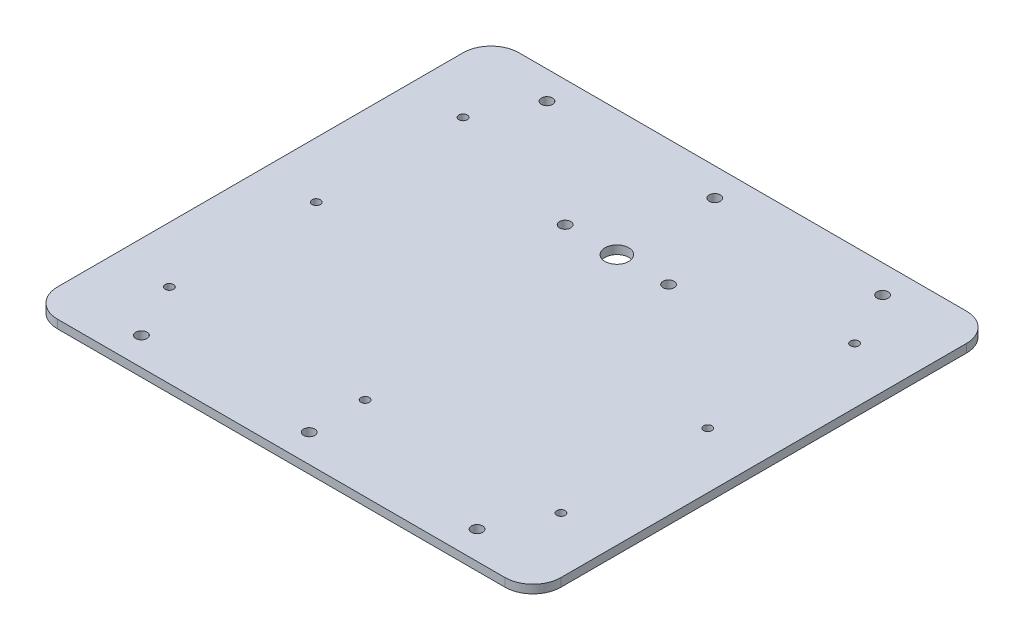
from build123d import *

# Parameters (mm, degrees)
SKETCH_1_R             = 2
SKETCH_1_R_2           = 4.25
SKETCH_1_R_3           = 1.5
SM_BASE_FLANGE_1_DEPTH = 3


# Sheet-metal steps are written as plain solids
with BuildPart() as part:
    # Sketch 1 → 基体-法兰1 (new body)
    with BuildSketch(Plane(origin=(0, 0, 0), x_dir=(1, 0, 0), z_dir=(0, 1, 0))):
        with BuildLine():
            Line((-80, 82.5), (80, 82.5))
            ThreePointArc((80, 82.5), (87.071067812, 79.571067812), (90, 72.5))
            Line((90, 72.5), (90, -72.5))
            ThreePointArc((90, -72.5), (87.071067812, -79.571067812), (80, -82.5))
            Line((80, -82.5), (-80, -82.5))
            ThreePointArc((-80, -82.5), (-87.071067812, -79.571067812), (-90, -72.5))
            Line((-90, -72.5), (-90, 72.5))
            ThreePointArc((-90, 72.5), (-87.071067812, 79.571067812), (-80, 82.5))
        make_face()
        with Locations(Location((0, 72.5, 0), (0, 0, 270))):
            Circle(SKETCH_1_R, mode=Mode.SUBTRACT)
        with Locations(Location((60, 72.5, 0), (0, 0, 270))):
            Circle(SKETCH_1_R, mode=Mode.SUBTRACT)
        with Locations(Location((-60, 72.5, 0), (0, 0, 270))):
            Circle(SKETCH_1_R, mode=Mode.SUBTRACT)
        with Locations(Location((0, -72.5, 0), (0, 0, 270))):
            Circle(SKETCH_1_R, mode=Mode.SUBTRACT)
        with Locations(Location((-60, -72.5, 0), (0, 0, 270))):
            Circle(SKETCH_1_R, mode=Mode.SUBTRACT)
        with Locations(Location((60, -72.5, 0), (0, 0, 270))):
            Circle(SKETCH_1_R, mode=Mode.SUBTRACT)
        with Locations(Location((0, 37.5, 0), (0, 0, 270))):
            Circle(SKETCH_1_R_2, mode=Mode.SUBTRACT)
        with Locations(Location((18.5, 37.5, 0), (0, 0, 270))):
            Circle(SKETCH_1_R, mode=Mode.SUBTRACT)
        with Locations(Location((-18.5, 37.5, 0), (0, 0, 270))):
            Circle(SKETCH_1_R, mode=Mode.SUBTRACT)
        with Locations(Location((70, 52.5, 0), (0, 0, 270))):
            Circle(SKETCH_1_R_3, mode=Mode.SUBTRACT)
        with Locations(Location((70, 0, 0), (0, 0, 270))):
            Circle(SKETCH_1_R_3, mode=Mode.SUBTRACT)
        with Locations(Location((70, -52.5, 0), (0, 0, 270))):
            Circle(SKETCH_1_R_3, mode=Mode.SUBTRACT)
        with Locations(Location((-70, 52.5, 0), (0, 0, 270))):
            Circle(SKETCH_1_R_3, mode=Mode.SUBTRACT)
        with Locations(Location((-70, 0, 0), (0, 0, 270))):
            Circle(SKETCH_1_R_3, mode=Mode.SUBTRACT)
        with Locations(Location((-70, -52.5, 0), (0, 0, 270))):
            Circle(SKETCH_1_R_3, mode=Mode.SUBTRACT)
        with Locations(Location((0, -52.5, 0), (0, 0, 270))):
            Circle(SKETCH_1_R_3, mode=Mode.SUBTRACT)
    extrude(amount=-SM_BASE_FLANGE_1_DEPTH)


solid = part.part
